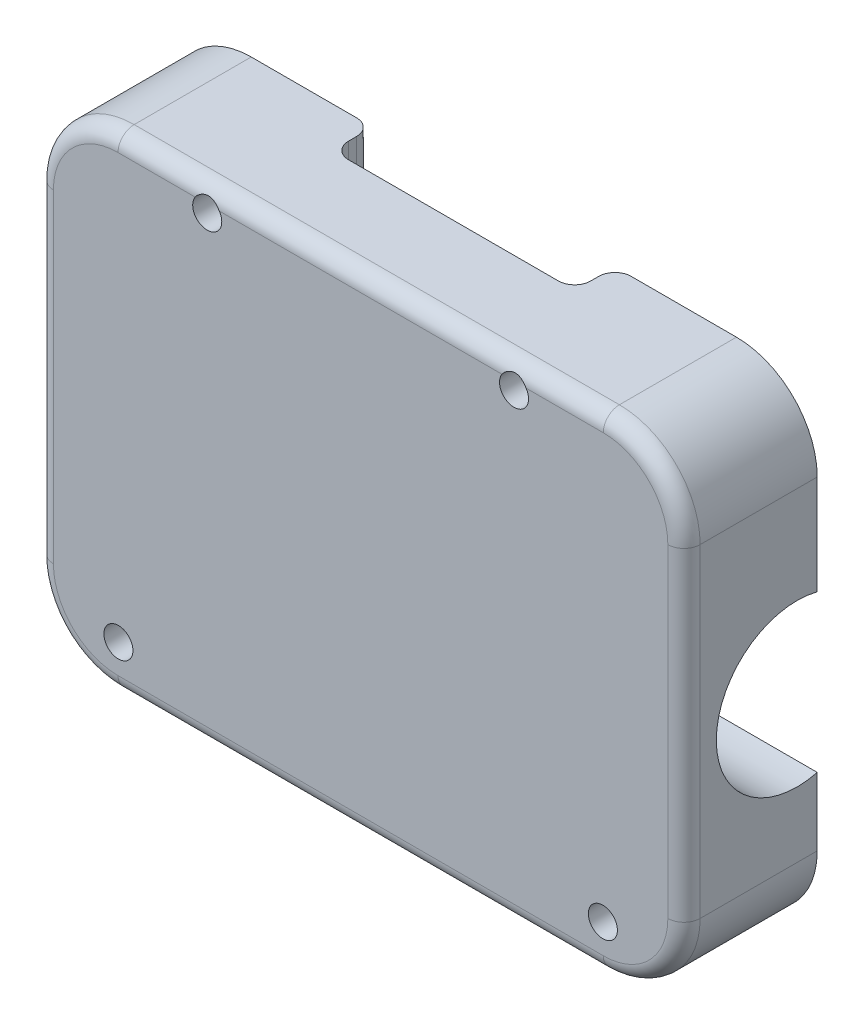
from build123d import *

# Parameters (mm, degrees)
SKETCH_2_W          = 80.1
SKETCH_2_H          = 60.1
EXTRUDE_1_DEPTH     = 28
CUT_EXTRUDE_1_DEPTH = 106
SKETCH_6_R          = 1.8
CUT_EXTRUDE_2_DEPTH = 106
CUT_EXTRUDE_3_DEPTH = 92
FILLET_2_R          = 2
FILLET_3_R          = 10
FILLET_4_R          = 2


with BuildPart() as part:
    # 草图2 → 凸台-拉伸1 (new body)
    with BuildSketch(Plane.XY):
        with Locations((40.05, -30.05)):
            Rectangle(SKETCH_2_W, SKETCH_2_H)
    extrude(amount=EXTRUDE_1_DEPTH)

    # 草图3 → 切除-拉伸1 (cut)
    with BuildSketch(Plane.ZY):
        with BuildLine():
            ThreePointArc((14, -22), (6.928932188, -24.928932188), (4, -32))
            Line((4, -32), (14, -32))
            Line((14, -32), (14, -22))
        make_face()
        with BuildLine():
            Line((14, -32), (4, -32))
            ThreePointArc((4, -32), (6.928932188, -39.071067812), (14, -42))
            Line((14, -42), (14, -32))
        make_face()
        with BuildLine():
            Line((14, -22), (14, -32))
            Line((14, -32), (24, -32))
            ThreePointArc((24, -32), (21.071067812, -24.928932188), (14, -22))
        make_face()
        with BuildLine():
            Line((24, -32), (14, -32))
            Line((14, -32), (14, -42))
            ThreePointArc((14, -42), (21.071067812, -39.071067812), (24, -32))
        make_face()
    extrude(amount=-CUT_EXTRUDE_1_DEPTH, mode=Mode.SUBTRACT)

    # 草图6 → 切除-拉伸2 (cut)
    with BuildSketch(Plane.XY.offset(28)):
        with Locations((21.05, -3)):
            Circle(SKETCH_6_R)
        with Locations((59.05, -3)):
            Circle(SKETCH_6_R)
        with Locations((10.05, -54.5)):
            Circle(SKETCH_6_R)
        with Locations((70.05, -54.5)):
            Circle(SKETCH_6_R)
    extrude(amount=-CUT_EXTRUDE_2_DEPTH, mode=Mode.SUBTRACT)

    # 草图9 → 切除-拉伸3 (cut)
    with BuildSketch(Plane(origin=(0, 0, 0), x_dir=(1, 0, 0), z_dir=(0, 1, 0))):
        Polygon((0, 0), (0, -11.5), (25.05, -11.5), (25.05, -16.5), (55.05, -16.5), (55.05, -11.5), (80.1, -11.5), (80.1, 0), align=None)
    extrude(amount=-CUT_EXTRUDE_3_DEPTH, mode=Mode.SUBTRACT)

    # 圆角2
    fillet_2_edges = [part.edges().sort_by_distance(p)[0] for p in [
        (55.05, -50.891229183, 11.5),
        (55.05, -11.158770817, 11.5),
        (55.05, -50.891229183, 16.5),
        (55.05, -11.158770817, 16.5),
        (25.05, -50.891229183, 16.5),
        (25.05, -11.158770817, 16.5),
        (25.05, -50.891229183, 11.5),
        (25.05, -11.158770817, 11.5),
    ]]
    fillet(fillet_2_edges, radius=FILLET_2_R)

    # 圆角3
    fillet_3_edges = [part.edges().sort_by_distance(p)[0] for p in [
        (80.1, -60.1, 19.75),
        (0, -60.1, 19.75),
        (0, 0, 19.75),
        (80.1, 0, 19.75),
    ]]
    fillet(fillet_3_edges, radius=FILLET_3_R)

    # 圆角4
    # the kernel refuses this fillet: 2 mm, written as the material it takes off along each edge
    with BuildSketch(Plane(origin=(0, -50.1, 28), x_dir=(0, 0, -1), z_dir=(0, 1, 0))) as fillet_4_piece_1:
        with BuildLine():
            CenterArc((FILLET_4_R, -FILLET_4_R), FILLET_4_R, 90, 90)
            Line((0, -FILLET_4_R), (0, 0))
            Line((0, 0), (FILLET_4_R, 0))
        make_face()
    extrude(amount=40.1, mode=Mode.SUBTRACT)
    with BuildSketch(Plane(origin=(10, 0, 28), x_dir=(0, -1, 0), z_dir=(1, 0, 0))) as fillet_4_piece_2:
        with BuildLine():
            CenterArc((FILLET_4_R, FILLET_4_R), FILLET_4_R, 180, 90)
            Line((0, FILLET_4_R), (0, 0))
            Line((0, 0), (FILLET_4_R, 0))
        make_face()
    extrude(amount=60.1, mode=Mode.SUBTRACT)
    with BuildSketch(Plane(origin=(80.1, -10, 28), x_dir=(-1, 0, 0), z_dir=(0, -1, 0))) as fillet_4_piece_3:
        with BuildLine():
            CenterArc((FILLET_4_R, FILLET_4_R), FILLET_4_R, 180, 90)
            Line((0, FILLET_4_R), (0, 0))
            Line((0, 0), (FILLET_4_R, 0))
        make_face()
    extrude(amount=40.1, mode=Mode.SUBTRACT)
    with BuildSketch(Plane(origin=(70.1, -60.1, 28), x_dir=(0, 0, -1), z_dir=(-1, 0, 0))) as fillet_4_piece_4:
        with BuildLine():
            CenterArc((FILLET_4_R, -FILLET_4_R), FILLET_4_R, 90, 90)
            Line((0, -FILLET_4_R), (0, 0))
            Line((0, 0), (FILLET_4_R, 0))
        make_face()
    extrude(amount=60.1, mode=Mode.SUBTRACT)
    with BuildSketch(Plane(origin=(70.1, -10, 28), x_dir=(1, 0, 0), z_dir=(0, -1, 0))) as fillet_4_piece_5:
        with BuildLine():
            CenterArc((10 - FILLET_4_R, -FILLET_4_R), FILLET_4_R, 0, 90)
            Line((10, -FILLET_4_R), (10, 0))
            Line((10, 0), (10 - FILLET_4_R, 0))
        make_face()
    revolve(axis=Axis((70.1, -10, 28), (0, 0, 1)), revolution_arc=90, mode=Mode.SUBTRACT)
    with BuildSketch(Plane(origin=(70.1, -50.1, 28), x_dir=(1, 0, 0), z_dir=(0, 1, 0))) as fillet_4_piece_6:
        with BuildLine():
            CenterArc((10 - FILLET_4_R, FILLET_4_R), FILLET_4_R, 270, 90)
            Line((10, FILLET_4_R), (10, 0))
            Line((10, 0), (10 - FILLET_4_R, 0))
        make_face()
    revolve(axis=Axis((70.1, -50.1, 28), (0, 0, -1)), revolution_arc=90, mode=Mode.SUBTRACT)
    with BuildSketch(Plane(origin=(10, -50.1, 28), x_dir=(-1, 0, 0), z_dir=(0, 1, 0))) as fillet_4_piece_7:
        with BuildLine():
            CenterArc((10 - FILLET_4_R, -FILLET_4_R), FILLET_4_R, 0, 90)
            Line((10 - FILLET_4_R, 0), (10, 0))
            Line((10, 0), (10, -FILLET_4_R))
        make_face()
    revolve(axis=Axis((10, -50.1, 28), (0, 0, 1)), revolution_arc=90, mode=Mode.SUBTRACT)
    with BuildSketch(Plane(origin=(10, -10, 28), x_dir=(-1, 0, 0), z_dir=(0, -1, 0))) as fillet_4_piece_8:
        with BuildLine():
            CenterArc((10 - FILLET_4_R, FILLET_4_R), FILLET_4_R, 270, 90)
            Line((10, FILLET_4_R), (10, 0))
            Line((10, 0), (10 - FILLET_4_R, 0))
        make_face()
    revolve(axis=Axis((10, -10, 28), (0, 0, -1)), revolution_arc=90, mode=Mode.SUBTRACT)


solid = part.part
